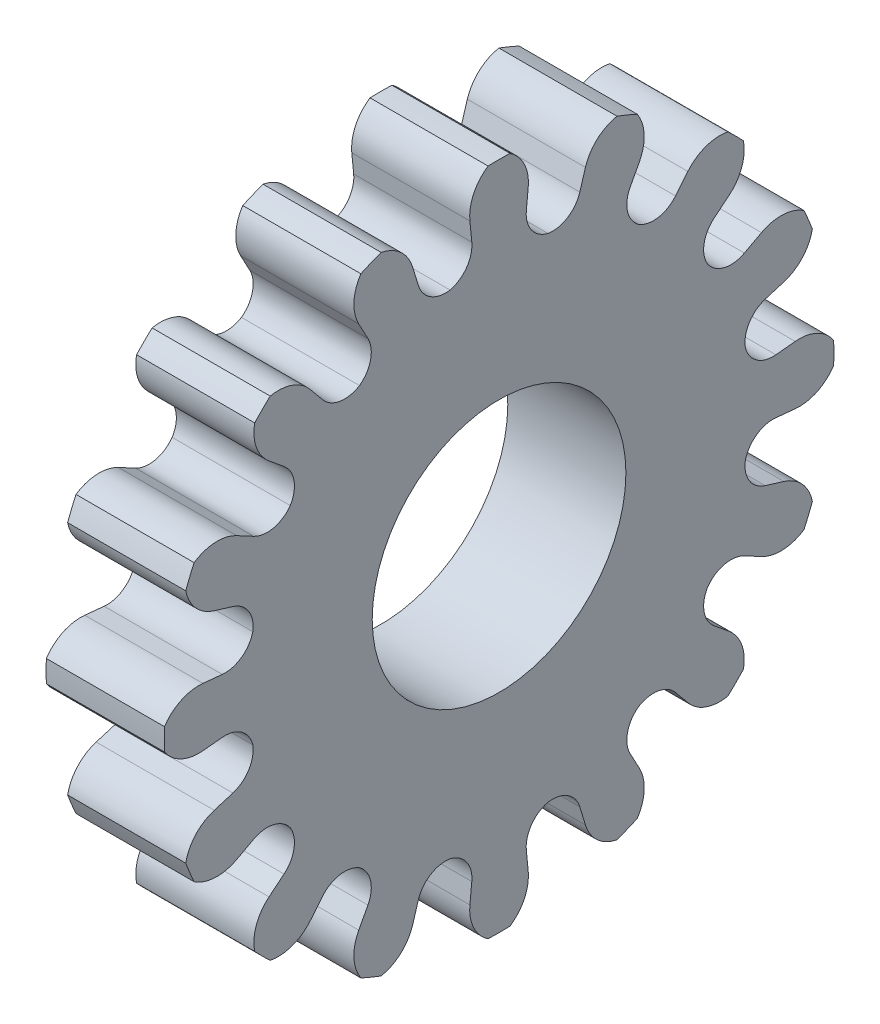
from build123d import *

# Parameters (mm, degrees)
BOSS_EXTRUDE2_DEPTH = 3.175
FILLET1_R           = 0.767540966
CIRPATTERN1_COUNT   = 16
SKETCH2_R           = 3.41
CUT_EXTRUDE1_DEPTH  = 14.117950488


with BuildPart() as part:
    # Sketch1 → Boss-Extrude2 (new body)
    with BuildSketch(Plane(origin=(0, 0, 0), x_dir=(0, 0, -1), z_dir=(1, 0, 0))):
        with BuildLine():
            Line((6.717496905, 0.661615697), (7.961477813, 0.784137123))
            ThreePointArc((7.961477813, 0.784137123), (8.546163052, 0.682503707), (8.995181287, 0.294471745))
            ThreePointArc((8.995181287, 0.294471745), (9, 0), (8.995181287, -0.294471745))
            ThreePointArc((8.995181287, -0.294471745), (8.546163052, -0.682503707), (7.961477813, -0.784137123))
            Line((7.961477813, -0.784137123), (6.717496905, -0.661615697))
            ThreePointArc((6.717496905, -0.661615697), (6.676941442, -0.990430703), (6.620300643, -1.316859674))
            Line((6.620300643, -1.316859674), (0, 0))
            Line((0, 0), (6.620300643, 1.316859674))
            ThreePointArc((6.620300643, 1.316859674), (6.676941442, 0.990430703), (6.717496905, 0.661615697))
        make_face()
    extrude(amount=BOSS_EXTRUDE2_DEPTH)

    # Fillet1
    # the kernel refuses this fillet: 0.767540966 mm, written as the material it adds along each edge
    with BuildSketch(Plane(origin=(0, 0.661615697, -6.717496905), x_dir=(0, 0.9888733768354266, 0.14875968736892464), z_dir=(1, 0, 0))) as fillet1_piece_1_section:
        with BuildLine():
            CenterArc((0.729311441, -0.766537545), FILLET1_R, 92.930055473, 84.139889054)
            Line((-0.037226104, -0.727303285), (0, 0))
            ThreePointArc((0, 0), (0.345038591, -0.008824407), (0.690077182, 0))
        make_face()
    fillet1_piece_1 = extrude(amount=3.175, mode=Mode.PRIVATE)
    fillet1_piece_1 = split(fillet1_piece_1, bisect_by=Plane(origin=(1.5875, 1.34516519, -6.762602082), z_dir=(0, -0.9807852804032304, -0.19509032201612872)), keep=Keep.TOP, mode=Mode.PRIVATE)
    add(fillet1_piece_1)
    with BuildSketch(Plane(origin=(0, -0.661615697, -6.717496905), x_dir=(0, -0.09801714032956141, -0.9951847266721968), z_dir=(1, 0, 0))) as fillet1_piece_2_section:
        with BuildLine():
            CenterArc((0.728255348, -0.767540966), FILLET1_R, 90, 84.139889054)
            ThreePointArc((-0.035274557, -0.68917503), (-0.008824407, -0.345038591), (0, 0))
            Line((0, 0), (0.728255348, 0))
        make_face()
    fillet1_piece_2 = extrude(amount=3.175, mode=Mode.PRIVATE)
    fillet1_piece_2 = split(fillet1_piece_2, bisect_by=Plane(origin=(1.5875, -1.34516519, -6.762602082), z_dir=(0, 0.9807852804032304, -0.19509032201612872)), keep=Keep.TOP, mode=Mode.PRIVATE)
    add(fillet1_piece_2)


with BuildPart() as cirpattern1_1:
    # CirPattern1: pattern copy
    add(part.part.rotate(Axis((0, 0, 0), (1, 0, 0)), 1 * 360 / CIRPATTERN1_COUNT))


with BuildPart() as cirpattern1_2:
    # CirPattern1: pattern copy
    add(part.part.rotate(Axis((0, 0, 0), (1, 0, 0)), 2 * 360 / CIRPATTERN1_COUNT))


with BuildPart() as cirpattern1_3:
    # CirPattern1: pattern copy
    add(part.part.rotate(Axis((0, 0, 0), (1, 0, 0)), 3 * 360 / CIRPATTERN1_COUNT))


with BuildPart() as cirpattern1_4:
    # CirPattern1: pattern copy
    add(part.part.rotate(Axis((0, 0, 0), (1, 0, 0)), 4 * 360 / CIRPATTERN1_COUNT))


with BuildPart() as cirpattern1_5:
    # CirPattern1: pattern copy
    add(part.part.rotate(Axis((0, 0, 0), (1, 0, 0)), 5 * 360 / CIRPATTERN1_COUNT))


with BuildPart() as cirpattern1_6:
    # CirPattern1: pattern copy
    add(part.part.rotate(Axis((0, 0, 0), (1, 0, 0)), 6 * 360 / CIRPATTERN1_COUNT))


with BuildPart() as cirpattern1_7:
    # CirPattern1: pattern copy
    add(part.part.rotate(Axis((0, 0, 0), (1, 0, 0)), 7 * 360 / CIRPATTERN1_COUNT))


with BuildPart() as cirpattern1_8:
    # CirPattern1: pattern copy
    add(part.part.rotate(Axis((0, 0, 0), (1, 0, 0)), 8 * 360 / CIRPATTERN1_COUNT))


with BuildPart() as cirpattern1_9:
    # CirPattern1: pattern copy
    add(part.part.rotate(Axis((0, 0, 0), (1, 0, 0)), 9 * 360 / CIRPATTERN1_COUNT))


with BuildPart() as cirpattern1_10:
    # CirPattern1: pattern copy
    add(part.part.rotate(Axis((0, 0, 0), (1, 0, 0)), 10 * 360 / CIRPATTERN1_COUNT))


with BuildPart() as cirpattern1_11:
    # CirPattern1: pattern copy
    add(part.part.rotate(Axis((0, 0, 0), (1, 0, 0)), 11 * 360 / CIRPATTERN1_COUNT))


with BuildPart() as cirpattern1_12:
    # CirPattern1: pattern copy
    add(part.part.rotate(Axis((0, 0, 0), (1, 0, 0)), 12 * 360 / CIRPATTERN1_COUNT))


with BuildPart() as cirpattern1_13:
    # CirPattern1: pattern copy
    add(part.part.rotate(Axis((0, 0, 0), (1, 0, 0)), 13 * 360 / CIRPATTERN1_COUNT))


with BuildPart() as cirpattern1_14:
    # CirPattern1: pattern copy
    add(part.part.rotate(Axis((0, 0, 0), (1, 0, 0)), 14 * 360 / CIRPATTERN1_COUNT))


with BuildPart() as cirpattern1_15:
    # CirPattern1: pattern copy
    add(part.part.rotate(Axis((0, 0, 0), (1, 0, 0)), 15 * 360 / CIRPATTERN1_COUNT))


with BuildPart() as cut_extrude1_tool:
    # Sketch2 → Cut-Extrude1 (new, through all)
    with BuildSketch(Plane(origin=(3.175, 0, 0), x_dir=(0, 0, -1), z_dir=(1, 0, 0))):
        Circle(SKETCH2_R)
    extrude(amount=-CUT_EXTRUDE1_DEPTH)


with BuildPart() as part_1:
    add(part.part)

    # Cut-Extrude1: cut by cut_extrude1_tool
    add(cut_extrude1_tool.part, mode=Mode.SUBTRACT)


with BuildPart() as cirpattern1_1_1:
    add(cirpattern1_1.part)

    # Cut-Extrude1: cut by cut_extrude1_tool
    add(cut_extrude1_tool.part, mode=Mode.SUBTRACT)


with BuildPart() as cirpattern1_2_1:
    add(cirpattern1_2.part)

    # Cut-Extrude1: cut by cut_extrude1_tool
    add(cut_extrude1_tool.part, mode=Mode.SUBTRACT)


with BuildPart() as cirpattern1_3_1:
    add(cirpattern1_3.part)

    # Cut-Extrude1: cut by cut_extrude1_tool
    add(cut_extrude1_tool.part, mode=Mode.SUBTRACT)


with BuildPart() as cirpattern1_4_1:
    add(cirpattern1_4.part)

    # Cut-Extrude1: cut by cut_extrude1_tool
    add(cut_extrude1_tool.part, mode=Mode.SUBTRACT)


with BuildPart() as cirpattern1_5_1:
    add(cirpattern1_5.part)

    # Cut-Extrude1: cut by cut_extrude1_tool
    add(cut_extrude1_tool.part, mode=Mode.SUBTRACT)


with BuildPart() as cirpattern1_6_1:
    add(cirpattern1_6.part)

    # Cut-Extrude1: cut by cut_extrude1_tool
    add(cut_extrude1_tool.part, mode=Mode.SUBTRACT)


with BuildPart() as cirpattern1_7_1:
    add(cirpattern1_7.part)

    # Cut-Extrude1: cut by cut_extrude1_tool
    add(cut_extrude1_tool.part, mode=Mode.SUBTRACT)


with BuildPart() as cirpattern1_8_1:
    add(cirpattern1_8.part)

    # Cut-Extrude1: cut by cut_extrude1_tool
    add(cut_extrude1_tool.part, mode=Mode.SUBTRACT)


with BuildPart() as cirpattern1_9_1:
    add(cirpattern1_9.part)

    # Cut-Extrude1: cut by cut_extrude1_tool
    add(cut_extrude1_tool.part, mode=Mode.SUBTRACT)


with BuildPart() as cirpattern1_10_1:
    add(cirpattern1_10.part)

    # Cut-Extrude1: cut by cut_extrude1_tool
    add(cut_extrude1_tool.part, mode=Mode.SUBTRACT)


with BuildPart() as cirpattern1_11_1:
    add(cirpattern1_11.part)

    # Cut-Extrude1: cut by cut_extrude1_tool
    add(cut_extrude1_tool.part, mode=Mode.SUBTRACT)


with BuildPart() as cirpattern1_12_1:
    add(cirpattern1_12.part)

    # Cut-Extrude1: cut by cut_extrude1_tool
    add(cut_extrude1_tool.part, mode=Mode.SUBTRACT)


with BuildPart() as cirpattern1_13_1:
    add(cirpattern1_13.part)

    # Cut-Extrude1: cut by cut_extrude1_tool
    add(cut_extrude1_tool.part, mode=Mode.SUBTRACT)


with BuildPart() as cirpattern1_14_1:
    add(cirpattern1_14.part)

    # Cut-Extrude1: cut by cut_extrude1_tool
    add(cut_extrude1_tool.part, mode=Mode.SUBTRACT)


with BuildPart() as cirpattern1_15_1:
    add(cirpattern1_15.part)

    # Cut-Extrude1: cut by cut_extrude1_tool
    add(cut_extrude1_tool.part, mode=Mode.SUBTRACT)


with BuildPart() as cirpattern1_13_2:
    add(cirpattern1_13_1.part)

    # Combine1: union CirPattern1_1, CirPattern1_14, CirPattern1_2, CirPattern1_15, CirPattern1_3, part, CirPattern1_4, CirPattern1_5, CirPattern1_6, CirPattern1_7, CirPattern1_8, CirPattern1_9, CirPattern1_10, CirPattern1_11, CirPattern1_12
    add(cirpattern1_1_1.part)
    add(cirpattern1_14_1.part)
    add(cirpattern1_2_1.part)
    add(cirpattern1_15_1.part)
    add(cirpattern1_3_1.part)
    add(part_1.part)
    add(cirpattern1_4_1.part)
    add(cirpattern1_5_1.part)
    add(cirpattern1_6_1.part)
    add(cirpattern1_7_1.part)
    add(cirpattern1_8_1.part)
    add(cirpattern1_9_1.part)
    add(cirpattern1_10_1.part)
    add(cirpattern1_11_1.part)
    add(cirpattern1_12_1.part)


solid = cirpattern1_13_2.part
